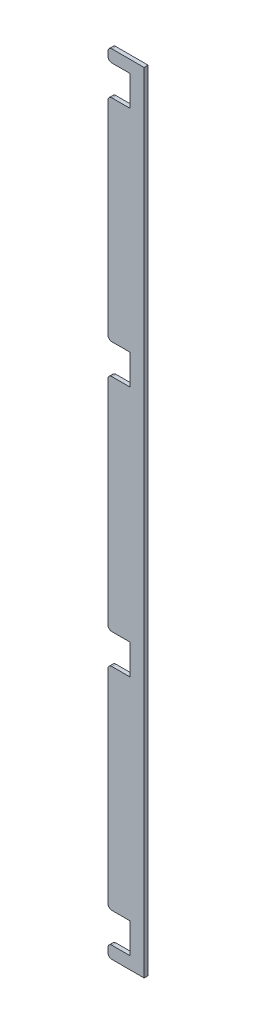
from build123d import *

# Parameters (mm, degrees)
BOSS_EXTRUDE1_DEPTH = 1


with BuildPart() as part:
    # Sketch1 → Boss-Extrude1 (new body)
    with BuildSketch(Plane.XY):
        with BuildLine():
            Line((-4.5, -182.595238095), (0, -182.595238095))
            Line((0, -182.595238095), (0, 13.404761905))
            Line((0, 13.404761905), (-4.5, 13.404761905))
            Line((-4.5, 13.404761905), (-8, 13.404761905))
            ThreePointArc((-8, 13.404761905), (-8.707106781, 13.111868686), (-9, 12.404761905))
            Line((-9, 12.404761905), (-9, 11.354761905))
            ThreePointArc((-9, 11.354761905), (-8.707106781, 10.647655124), (-8, 10.354761905))
            Line((-8, 10.354761905), (-4.5, 10.354761905))
            Line((-4.5, 10.354761905), (-3.5, 10.354761905))
            Line((-3.5, 10.354761905), (-3.5, 2.854761905))
            Line((-3.5, 2.854761905), (-4.5, 2.854761905))
            Line((-4.5, 2.854761905), (-8, 2.854761905))
            ThreePointArc((-8, 2.854761905), (-8.707106781, 2.561868686), (-9, 1.854761905))
            Line((-9, 1.854761905), (-9, -48.645238095))
            ThreePointArc((-9, -48.645238095), (-8.707106781, -49.352344876), (-8, -49.645238095))
            Line((-8, -49.645238095), (-4.5, -49.645238095))
            Line((-4.5, -49.645238095), (-3.5, -49.645238095))
            Line((-3.5, -49.645238095), (-3.5, -57.145238095))
            Line((-3.5, -57.145238095), (-4.5, -57.145238095))
            Line((-4.5, -57.145238095), (-8, -57.145238095))
            ThreePointArc((-8, -57.145238095), (-8.707106781, -57.438131314), (-9, -58.145238095))
            Line((-9, -58.145238095), (-9, -111.045238095))
            ThreePointArc((-9, -111.045238095), (-8.707106781, -111.752344876), (-8, -112.045238095))
            Line((-8, -112.045238095), (-4.5, -112.045238095))
            Line((-4.5, -112.045238095), (-3.5, -112.045238095))
            Line((-3.5, -112.045238095), (-3.5, -119.545238095))
            Line((-3.5, -119.545238095), (-4.5, -119.545238095))
            Line((-4.5, -119.545238095), (-8, -119.545238095))
            ThreePointArc((-8, -119.545238095), (-8.707106781, -119.838131314), (-9, -120.545238095))
            Line((-9, -120.545238095), (-9, -171.045238095))
            ThreePointArc((-9, -171.045238095), (-8.707106781, -171.752344876), (-8, -172.045238095))
            Line((-8, -172.045238095), (-4.5, -172.045238095))
            Line((-4.5, -172.045238095), (-3.5, -172.045238095))
            Line((-3.5, -172.045238095), (-3.5, -179.545238095))
            Line((-3.5, -179.545238095), (-4.5, -179.545238095))
            Line((-4.5, -179.545238095), (-8, -179.545238095))
            ThreePointArc((-8, -179.545238095), (-8.707106781, -179.838131314), (-9, -180.545238095))
            Line((-9, -180.545238095), (-9, -181.595238095))
            ThreePointArc((-9, -181.595238095), (-8.707106781, -182.302344876), (-8, -182.595238095))
            Line((-8, -182.595238095), (-4.5, -182.595238095))
        make_face()
    extrude(amount=BOSS_EXTRUDE1_DEPTH)


solid = part.part
